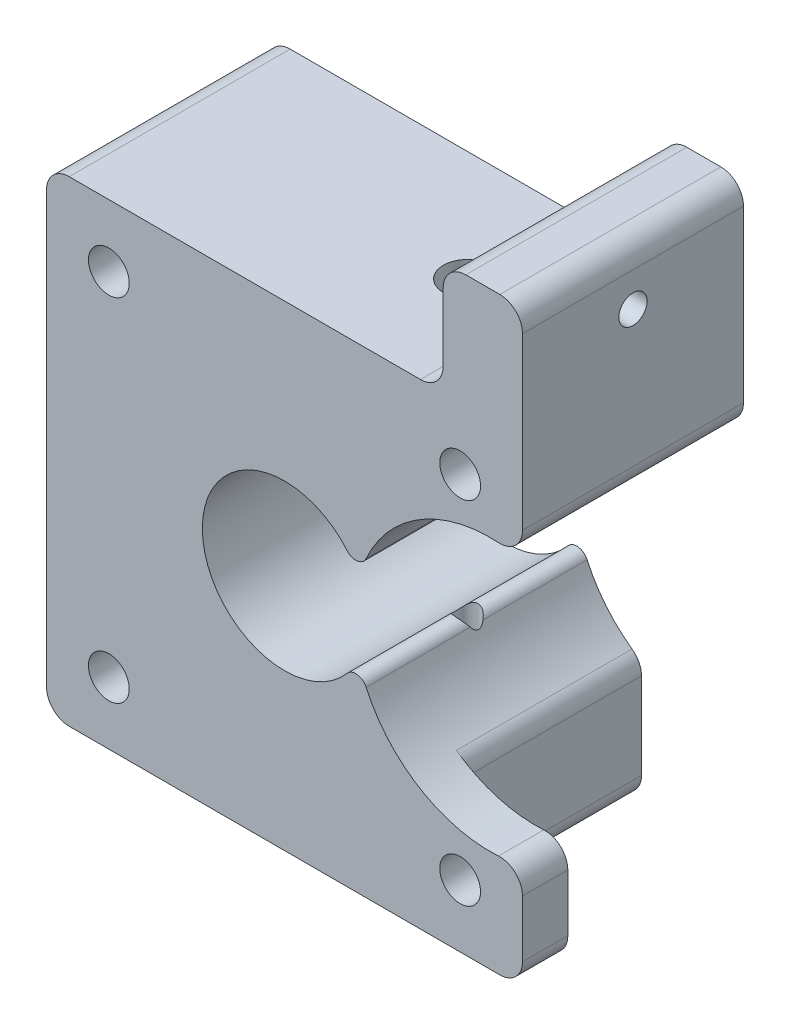
from build123d import *

# Parameters (mm, degrees)
BOSS_EXTRUDE1_DEPTH       = 19.5
SKETCH2_R                 = 7.25
CUT_EXTRUDE1_DEPTH        = 22
M3_CLEARANCE_HOLE1_D      = 3.6
SKETCH6_R                 = 12
CUT_EXTRUDE2_DEPTH        = 22
CUT_EXTRUDE3_START        = 15.5
CUT_EXTRUDE3_DEPTH        = 15.5
M3X0_5_TAPPED_HOLE1_D     = 2.5
FILLET1_R                 = 1
M5X0_8_TAPPED_HOLE1_D     = 4.2
M5X0_8_TAPPED_HOLE1_DEPTH = 21
M5X0_8_TAPPED_HOLE1_TIP   = 1.2618073
SKETCH12_R                = 1
CUT_EXTRUDE4_DEPTH        = 51.845353932
CHAMFER1_SIZE             = 2
CHAMFER1_SIZE2            = 3.464101615
FILLET3_R                 = 2


with BuildPart() as part:
    # Sketch1 → Boss-Extrude1 (new body)
    with BuildSketch(Plane.XY):
        Polygon((21, -21), (21, 31), (14, 31), (14, 21), (-21, 21), (-21, -21), align=None)
    extrude(amount=BOSS_EXTRUDE1_DEPTH)

    # Sketch2 → Cut-Extrude1 (cut)
    with BuildSketch(Plane.XY.offset(19.5)):
        Circle(SKETCH2_R)
    extrude(amount=-CUT_EXTRUDE1_DEPTH, mode=Mode.SUBTRACT)

    # M3 Clearance Hole1 (through all)
    with Locations(Plane.XY.offset(19.5)):
        with Locations((-15.5, 15.5), (15.5, 15.5), (15.5, -15.5), (-15.5, -15.5)):
            Hole(M3_CLEARANCE_HOLE1_D / 2)

    # Sketch6 → Cut-Extrude2 (cut)
    with BuildSketch(Plane.XY.offset(19.5)):
        with Locations((18.1475, 0)):
            Circle(SKETCH6_R)
    extrude(amount=-CUT_EXTRUDE2_DEPTH, mode=Mode.SUBTRACT)

    # Sketch7 → Cut-Extrude3 (cut)
    with BuildSketch(Plane.XY.offset(CUT_EXTRUDE3_START)):
        with BuildLine():
            Line((21, -11.656038939), (21, -21))
            Line((21, -21), (12, -21))
            Line((12, -21), (12, -10.305738389))
            ThreePointArc((12, -10.305738389), (16.367026989, -11.867178092), (21, -11.656038939))
        make_face()
    extrude(amount=-CUT_EXTRUDE3_DEPTH, mode=Mode.SUBTRACT)

    # M3x0.5 Tapped Hole1 (through all)
    with Locations(Plane.ZY.offset(-14)):
        with Locations((9.75, 26)):
            Hole(M3X0_5_TAPPED_HOLE1_D / 2)

    # Fillet1
    fillet1_edges = [part.edges().sort_by_distance(p)[0] for p in [
        (6.554463597, 3.098629852, 9.75),
        (6.554463597, -3.098629852, 9.75),
    ]]
    fillet(fillet1_edges, radius=FILLET1_R)

    # M5x0.8 Tapped Hole1
    with Locations(Plane(origin=(0, 21, 0), x_dir=(1, 0, 0), z_dir=(0, 1, 0))):
        with Locations((6.375, -9.75)):
            Hole(M5X0_8_TAPPED_HOLE1_D / 2, depth=M5X0_8_TAPPED_HOLE1_DEPTH)
            with Locations((0, 0, -(M5X0_8_TAPPED_HOLE1_DEPTH + M5X0_8_TAPPED_HOLE1_TIP / 2))):  # 118° drill point
                Cone(0, M5X0_8_TAPPED_HOLE1_D / 2, M5X0_8_TAPPED_HOLE1_TIP, mode=Mode.SUBTRACT)

    # Sketch12 → Cut-Extrude4 (cut, through all)
    with BuildSketch(Plane(origin=(0, 21, 0), x_dir=(1, 0, 0), z_dir=(0, 1, 0))):
        with Locations((6.375, -9.75)):
            Circle(SKETCH12_R)
    extrude(amount=-CUT_EXTRUDE4_DEPTH, mode=Mode.SUBTRACT)

    # Chamfer1
    chamfer1_edges = [part.edges().sort_by_distance(p)[0] for p in [
        (5.375, -21, 9.75),
    ]]
    chamfer1_side = [part.faces().sort_by_distance(p)[0] for p in [
        (-3.432762316, -21, 10.162503189),
    ]]
    chamfer(chamfer1_edges, length=CHAMFER1_SIZE, length2=CHAMFER1_SIZE2, reference=chamfer1_side[0])

    # Fillet3
    fillet3_edges = [part.edges().sort_by_distance(p)[0] for p in [
        (12, -21, 7.75),
        (12, -10.305738389, 7.75),
        (21, -11.656038939, 17.5),
        (21, -21, 17.5),
        (-21, -21, 9.75),
        (-21, 21, 9.75),
        (14, 21, 9.75),
        (14, 31, 9.75),
        (21, 31, 9.75),
        (21, 11.656038939, 9.75),
    ]]
    fillet(fillet3_edges, radius=FILLET3_R)


solid = part.part
